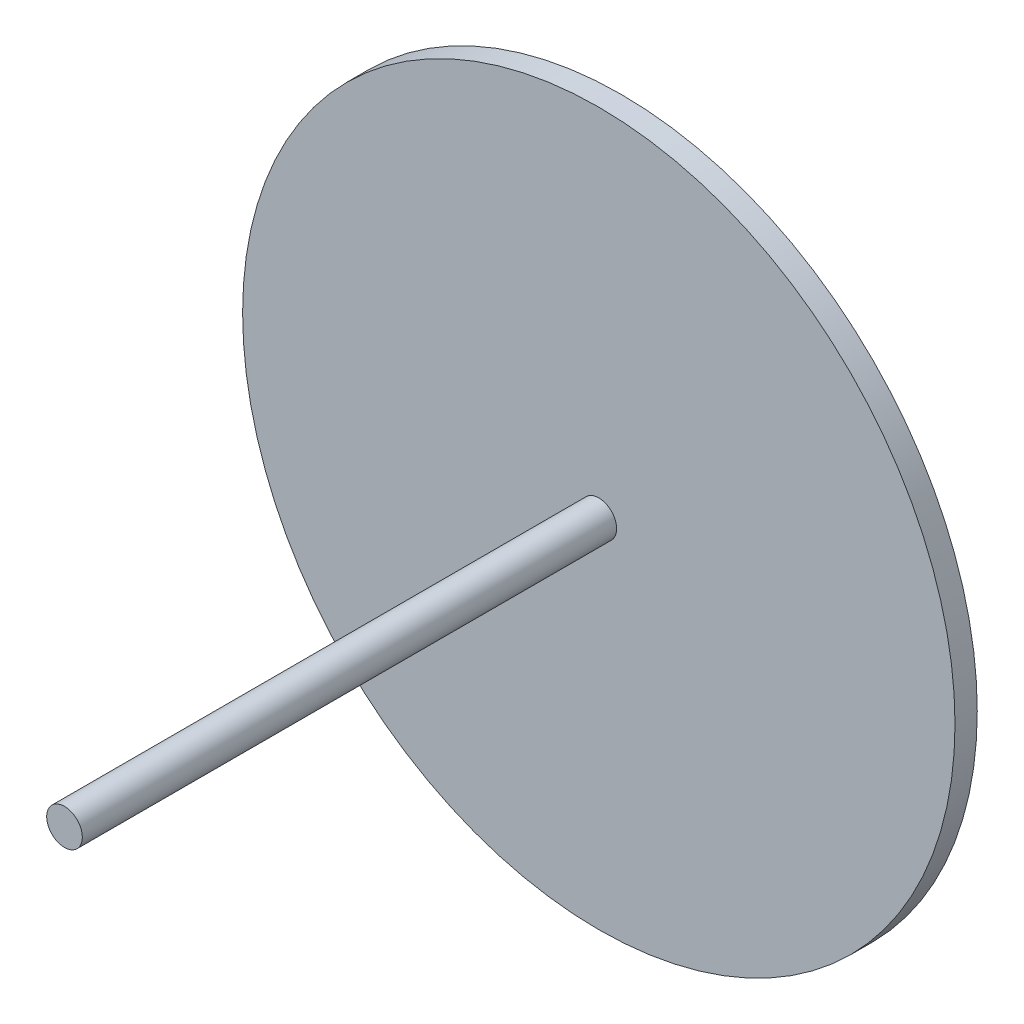
from build123d import *

# Parameters (mm, degrees)
SKETCH_1_R      = 40
EXTRUDE_1_DEPTH = 2.5
SKETCH_2_R      = 2
EXTRUDE_2_DEPTH = 60


with BuildPart() as part:
    # 草图1 → 凸台-拉伸1 (new body)
    with BuildSketch(Plane.XY):
        Circle(SKETCH_1_R)
    extrude(amount=EXTRUDE_1_DEPTH)

    # 草图2 → 凸台-拉伸2 (add)
    with BuildSketch(Plane.XY.offset(2.5)):
        Circle(SKETCH_2_R)
    extrude(amount=EXTRUDE_2_DEPTH)


solid = part.part
